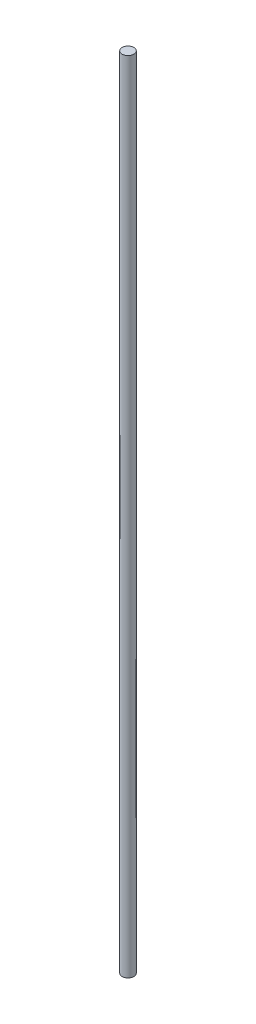
from build123d import *

# Parameters (mm, degrees)
SKETCH1_R           = 6.35
BOSS_EXTRUDE1_DEPTH = 431.8


with BuildPart() as part:
    # Sketch1 → Boss-Extrude1 (new, symmetric)
    with BuildSketch(Plane(origin=(0, 0, 0), x_dir=(1, 0, 0), z_dir=(0, 1, 0))):
        Circle(SKETCH1_R)
    extrude(amount=BOSS_EXTRUDE1_DEPTH, both=True)


solid = part.part
